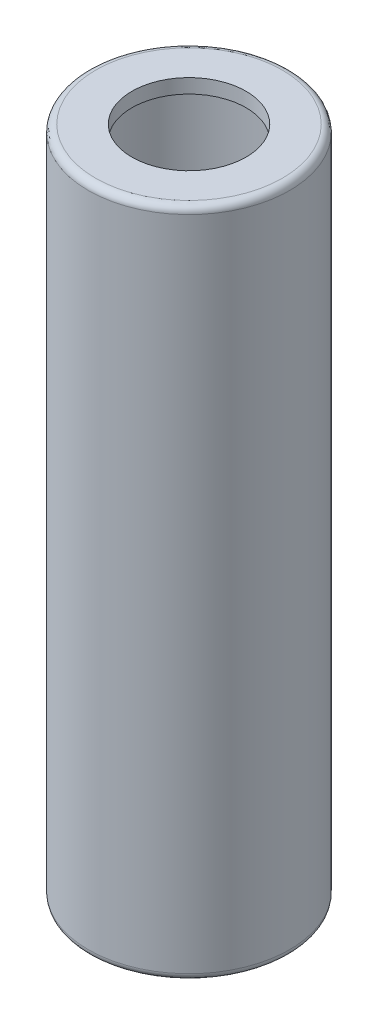
from build123d import *

# Parameters (mm, degrees)
SKETCH_1_R          = 14.1
EXTRUDE_1_DEPTH     = 94
SKETCH_2_R          = 12.5
CUT_EXTRUDE_1_DEPTH = 92
FILLET_2_R          = 1
FILLET_3_R          = 1
FILLET_4_R          = 1
SKETCH_3_R          = 8
CUT_EXTRUDE_2_DEPTH = 2


with BuildPart() as part:
    # Эскиз1 → Бобышка-Вытянуть1 (new body)
    with BuildSketch(Plane(origin=(0, 0, 0), x_dir=(1, 0, 0), z_dir=(0, 1, 0))):
        with Locations(Location((0, 0, 0), (0, 0, 270))):
            Circle(SKETCH_1_R)
    extrude(amount=EXTRUDE_1_DEPTH)

    # Эскиз2 → Вырез-Вытянуть1 (cut)
    with BuildSketch(Plane.XZ):
        with Locations(Location((0, 0, 0), (0, 0, 270))):
            Circle(SKETCH_2_R)
    extrude(amount=-CUT_EXTRUDE_1_DEPTH, mode=Mode.SUBTRACT)

    # Скругление2
    fillet_2_edges = [part.edges().sort_by_distance(p)[0] for p in [
        (0, 0, 12.5),
    ]]
    fillet(fillet_2_edges, radius=FILLET_2_R)

    # Скругление3
    # the kernel refuses this fillet: 1 mm, written as the material it takes off along each edge
    with BuildSketch(Plane(origin=(0, 0, 0), x_dir=(0, 0, 1), z_dir=(-1, 0, 0))) as fillet_3_piece_1:
        with BuildLine():
            CenterArc((13.1, 0.916515139), FILLET_3_R, 293.578178478, 66.421821522)
            Line((14.1, 0.916515139), (14.12, 0.916515139))
            Line((14.12, 0.916515139), (14.12, 0))
            Line((14.12, 0), (14.1, -0.02))
            ThreePointArc((14.1, -0.02), (13.8, -0.02), (13.508, -0.018330303))
            Line((13.508, -0.018330303), (13.5, 0))
        make_face()
    revolve(axis=Axis((0, 0, 0), (0, 1, 0)), mode=Mode.SUBTRACT)

    # Скругление4
    fillet_4_edges = [part.edges().sort_by_distance(p)[0] for p in [
        (0, 94, -14.1),
    ]]
    fillet(fillet_4_edges, radius=FILLET_4_R)

    # Эскиз3 → Вырез-Вытянуть2 (cut)
    with BuildSketch(Plane(origin=(0, 94, 0), x_dir=(1, 0, 0), z_dir=(0, 1, 0))):
        with Locations(Location((0, 0, 0), (0, 0, 270))):
            Circle(SKETCH_3_R)
    extrude(amount=-CUT_EXTRUDE_2_DEPTH, mode=Mode.SUBTRACT)


solid = part.part
